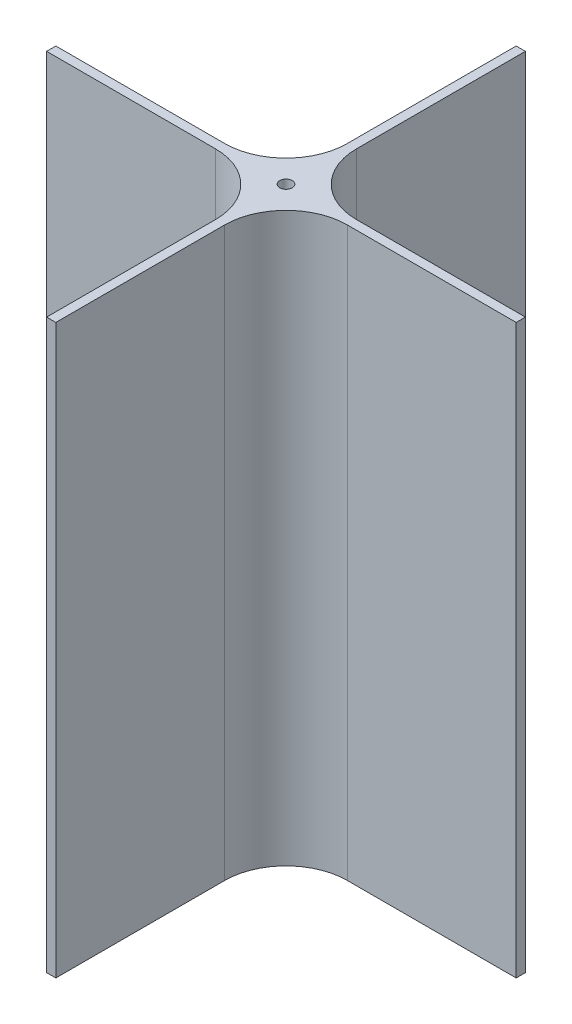
from build123d import *

# Parameters (mm, degrees)
BOSS_EXTRUDE1_DEPTH = 185
FILLET1_R           = 20
CUT_EXTRUDE2_DEPTH  = 13
SKETCH9_R           = 1.5
CUT_EXTRUDE3_DEPTH  = 217.618180303
SKETCH10_R          = 2.05
CUT_EXTRUDE4_DEPTH  = 13


with BuildPart() as part:
    # Sketch1 → Boss-Extrude1 (new body)
    with BuildSketch(Plane(origin=(0, 0, 0), x_dir=(1, 0, 0), z_dir=(0, 1, 0))):
        Polygon((-1.5, 1.5), (-1.5, 76.5), (1.5, 76.5), (1.5, 1.5), (76.5, 1.5), (76.5, -1.5), (1.5, -1.5), (1.5, -76.5), (-1.5, -76.5), (-1.5, -1.5), (-76.5, -1.5), (-76.5, 1.5), align=None)
    extrude(amount=BOSS_EXTRUDE1_DEPTH)

    # Fillet1
    fillet1_edges = [part.edges().sort_by_distance(p)[0] for p in [
        (-1.5, 92.5, -1.5),
        (1.5, 92.5, 1.5),
        (1.5, 92.5, -1.5),
        (-1.5, 92.5, 1.5),
    ]]
    fillet(fillet1_edges, radius=FILLET1_R)

    # Sketch6 → Cut-Extrude2 (cut)
    with BuildSketch(Plane.XZ):
        with BuildLine():
            Line((-1.996074518, -0.125245825), (-0.125245825, -1.996074518))
            ThreePointArc((-0.125245825, -1.996074518), (1.414213562, 1.414213562), (-1.996074518, -0.125245825))
        make_face()
        Polygon((-3.889087297, -1.060660172), (-1.060660172, -3.889087297), (-1.767766953, -4.596194078), (-4.596194078, -1.767766953), align=None)
    extrude(amount=-CUT_EXTRUDE2_DEPTH, mode=Mode.SUBTRACT)

    # Sketch9 → Cut-Extrude3 (cut, through all)
    with BuildSketch(Plane(origin=(-3.181980515, 0, -3.181980515), x_dir=(0.7071067811865475, 0, -0.7071067811865476), z_dir=(0.7071067811865476, 0, 0.7071067811865475))):
        with Locations((0, 11.5)):
            Circle(SKETCH9_R)
    extrude(amount=-CUT_EXTRUDE3_DEPTH, mode=Mode.SUBTRACT)

    # Sketch10 → Cut-Extrude4 (cut)
    with BuildSketch(Plane(origin=(0, 185, 0), x_dir=(1, 0, 0), z_dir=(0, 1, 0))):
        Circle(SKETCH10_R)
    extrude(amount=-CUT_EXTRUDE4_DEPTH, mode=Mode.SUBTRACT)


solid = part.part
